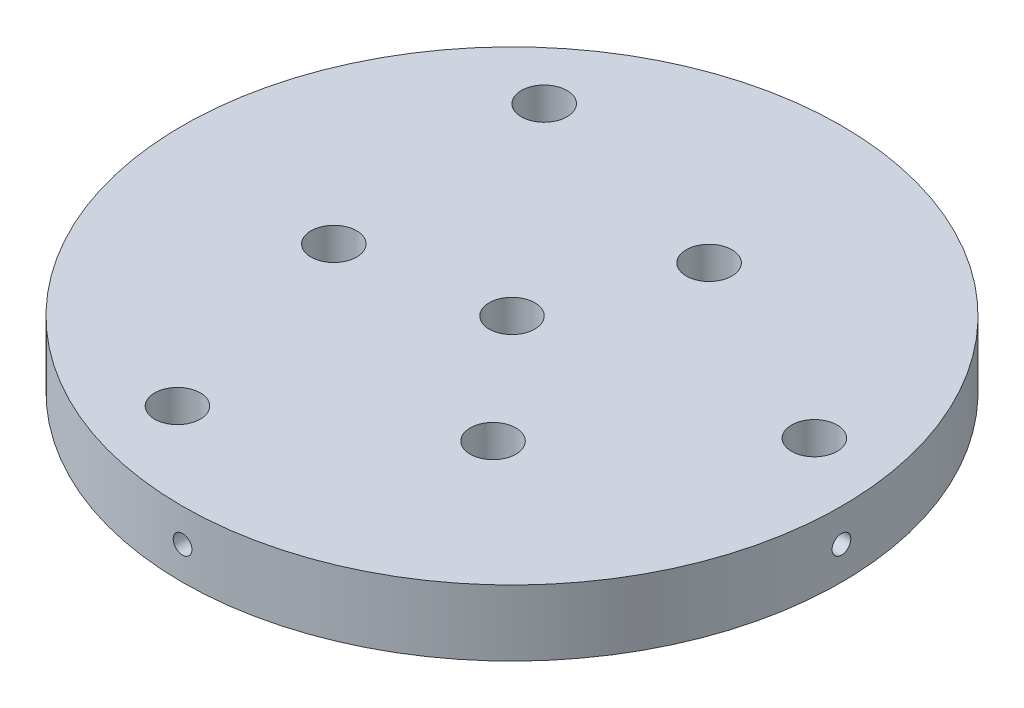
from build123d import *

# Parameters (mm, degrees)
SKETCH1_R           = 47.625
SKETCH1_R_2         = 3.3
BOSS_EXTRUDE1_DEPTH = 4.7625
SKETCH2_R           = 1.35255
CUT_EXTRUDE1_DEPTH  = 12.7
CIRPATTERN1_COUNT   = 4
SKETCH4_R           = 3.3
CUT_EXTRUDE2_DEPTH  = 69.022105941


with BuildPart() as part:
    # Sketch1 → Boss-Extrude1 (new, symmetric)
    with BuildSketch(Plane(origin=(0, 0, 0), x_dir=(1, 0, 0), z_dir=(0, 1, 0))):
        Circle(SKETCH1_R)
        Circle(SKETCH1_R_2, mode=Mode.SUBTRACT)
    extrude(amount=BOSS_EXTRUDE1_DEPTH, both=True)

    # Sketch2 → Cut-Extrude1 (cut)
    with BuildSketch(Plane.XY.offset(50.8)):
        Circle(SKETCH2_R)
    cut_extrude1 = extrude(amount=-CUT_EXTRUDE1_DEPTH, mode=Mode.SUBTRACT)

    # CirPattern1: Cut-Extrude1 ×4 about axis
    cirpattern1_axis = Axis((0, 4.7625, 0), (0, -1, 0))
    for i in range(1, CIRPATTERN1_COUNT):
        add(cut_extrude1.rotate(cirpattern1_axis, i * 360 / CIRPATTERN1_COUNT), mode=Mode.SUBTRACT)

    # Sketch4 → Cut-Extrude2 (cut, through all)
    with BuildSketch(Plane(origin=(0, 4.7625, 0), x_dir=(1, 0, 0), z_dir=(0, 1, 0))):
        with Locations((-12.900657786, -35.444265963)):
            Circle(SKETCH4_R)
        with Locations((-24.24530585, 28.89443035)):
            Circle(SKETCH4_R)
        with Locations((37.145963636, 6.549835613)):
            Circle(SKETCH4_R)
        with Locations((14.285954625, -17.025337748)):
            Circle(SKETCH4_R)
        with Locations((-21.887352311, -3.859330749)):
            Circle(SKETCH4_R)
        with Locations((7.601397685, 20.884668497)):
            Circle(SKETCH4_R)
    extrude(amount=-CUT_EXTRUDE2_DEPTH, mode=Mode.SUBTRACT)


solid = part.part
